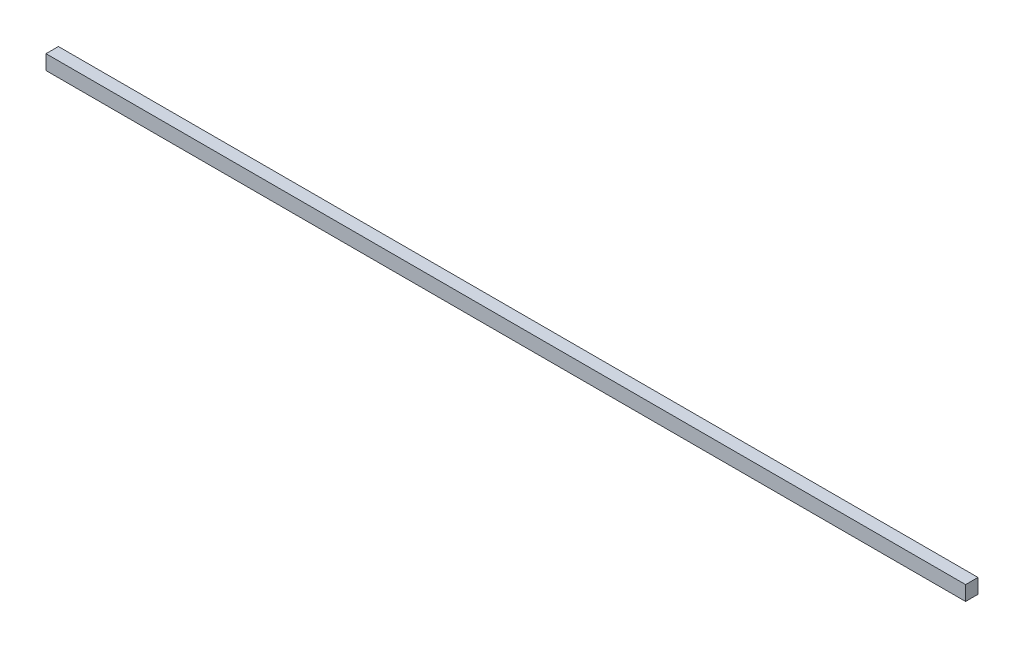
from build123d import *

# Parameters (mm, degrees)
SKETCH_1_W      = 740.908813226
SKETCH_1_H      = 11.802970169
EXTRUDE_1_DEPTH = 10


with BuildPart() as part:
    # Эскиз1 → Бобышка-Вытянуть1 (new body)
    with BuildSketch(Plane.XY):
        with Locations((215.371616211, 42.338160755)):
            Rectangle(SKETCH_1_W, SKETCH_1_H)
    extrude(amount=EXTRUDE_1_DEPTH)


solid = part.part
